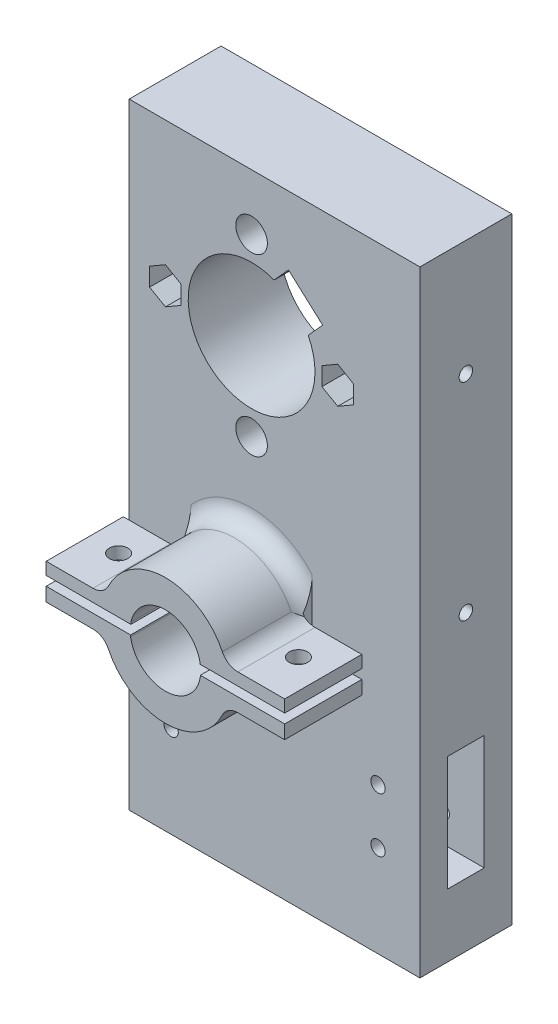
from build123d import *

# Parameters (mm, degrees)
SKETCH1_W           = 42.62295082
SKETCH1_H           = 50
SKETCH1_R           = 2.75
BOSS_EXTRUDE1_DEPTH = 16
SKETCH2_R           = 11.04
CUT_EXTRUDE2_DEPTH  = 37.540101042
SKETCH3_R           = 1.75
CUT_EXTRUDE3_DEPTH  = 10
CUT_EXTRUDE6_START  = -5
CUT_EXTRUDE6_DEPTH  = 32.540101042
SKETCH30_W          = 42.62295082
SKETCH30_H          = 16
BOSS_EXTRUDE8_DEPTH = 20.23
SKETCH10_W          = 42.62295082
SKETCH10_H          = 22
BOSS_EXTRUDE2_DEPTH = 16
SKETCH14_W          = 6.4
SKETCH14_H          = 16
CUT_EXTRUDE7_DEPTH  = 82.194758677
BOSS_EXTRUDE3_DEPTH = 8
CUT_EXTRUDE9_DEPTH  = 8
SKETCH18_W          = 0.9
SKETCH18_H          = 4
SKETCH18_W_2        = 1.8
CUT_EXTRUDE10_DEPTH = 10.2
SKETCH20_W          = 8
SKETCH20_H          = 16
BOSS_EXTRUDE5_DEPTH = 16
SKETCH21_W          = 8
SKETCH21_H          = 6.4
CUT_EXTRUDE11_DEPTH = 16
SKETCH24_W          = 50.62295082
SKETCH24_H          = 4.8
BOSS_EXTRUDE6_DEPTH = 15
SKETCH25_W          = 50.62295082
SKETCH25_H          = 15
BOSS_EXTRUDE7_DEPTH = 11.2
SKETCH26_R          = 1
CUT_EXTRUDE13_DEPTH = 10
SKETCH27_W          = 4
SKETCH27_H          = 1.8
CUT_EXTRUDE14_DEPTH = 10.2
BOSS_EXTRUDE9_DEPTH = 15
SKETCH35_R          = 6.145
CUT_EXTRUDE17_DEPTH = 89.752101331
SKETCH46_R          = 1.6
CUT_EXTRUDE29_DEPTH = 116.405526257
SKETCH47_W          = 10.199129155
SKETCH47_H          = 1.570077555
CUT_EXTRUDE30_DEPTH = 93.638736448
FILLET1_R           = 3
FILLET2_R           = 3
CUT_EXTRUDE31_DEPTH = 93.638736482
SKETCH50_W          = 6.4
SKETCH50_H          = 4
CUT_EXTRUDE33_DEPTH = 102.417237469
SKETCH51_R          = 1.25
CUT_EXTRUDE34_DEPTH = 93.638736482
CUT_EXTRUDE35_REACH = 94.639
SKETCH52_W          = 20
SKETCH52_H          = 14


with BuildPart() as part:
    # Sketch1 → Boss-Extrude1 (new body)
    with BuildSketch(Plane.XY):
        Rectangle(SKETCH1_W, SKETCH1_H)
        with Locations((0, 15.25)):
            Circle(SKETCH1_R, mode=Mode.SUBTRACT)
        with Locations((0, -15.25)):
            Circle(SKETCH1_R, mode=Mode.SUBTRACT)
    extrude(amount=BOSS_EXTRUDE1_DEPTH)

    # Sketch2 → Cut-Extrude2 (cut, through all)
    with BuildSketch(Plane.XY):
        Circle(SKETCH2_R)
    extrude(amount=CUT_EXTRUDE2_DEPTH, mode=Mode.SUBTRACT)

    # Sketch3 → Cut-Extrude3 (cut)
    with BuildSketch(Plane(origin=(0, 0, 0), x_dir=(-1, 0, 0), z_dir=(0, 0, -1))):
        with Locations((-15, 0)):
            Circle(SKETCH3_R)
        with Locations(Location((15, 0, 0), (0, 0, 180))):
            Circle(SKETCH3_R)
    extrude(amount=-CUT_EXTRUDE3_DEPTH, mode=Mode.SUBTRACT)

    # Sketch9 → Cut-Extrude6 (cut, through all)
    with BuildSketch(Plane(origin=(0, 0, 0), x_dir=(-1, 0, 0), z_dir=(0, 0, -1)).offset(CUT_EXTRUDE6_START)):
        Polygon((-15, 3.175426481), (-17.75, 1.58771324), (-17.75, -1.58771324), (-15, -3.175426481), (-12.25, -1.58771324), (-12.25, 1.58771324), align=None)
        Polygon((12.25, 1.58771324), (15, 3.175426481), (17.75, 1.58771324), (17.75, -1.58771324), (15, -3.175426481), (12.25, -1.58771324), align=None)
    extrude(amount=-CUT_EXTRUDE6_DEPTH, mode=Mode.SUBTRACT)

    # Sketch30 → Boss-Extrude8 (add)
    with BuildSketch(Plane.XZ.offset(25)):
        with Locations((0, 8)):
            Rectangle(SKETCH30_W, SKETCH30_H)
    extrude(amount=BOSS_EXTRUDE8_DEPTH)

    # Sketch10 → Boss-Extrude2 (add)
    with BuildSketch(Plane.XY):
        with Locations((0, -56.23)):
            Rectangle(SKETCH10_W, SKETCH10_H)
    extrude(amount=BOSS_EXTRUDE2_DEPTH)

    # Sketch14 → Cut-Extrude7 (cut, through all)
    with BuildSketch(Plane.ZY.offset(21.31147541)):
        with Locations((8, -59.23)):
            Rectangle(SKETCH14_W, SKETCH14_H)
    extrude(amount=-CUT_EXTRUDE7_DEPTH, mode=Mode.SUBTRACT)

    # Sketch16 → Boss-Extrude3 (add)
    with BuildSketch(Plane(origin=(21.31147541, 0, 0), x_dir=(0, 0, -1), z_dir=(1, 0, 0))):
        Polygon((-11.2, -51.23), (-8, -51.23), (-8, 25), (-16, 25), (-16, -51.23), align=None)
        Polygon((-8, 25), (-8, -51.23), (-4.8, -51.23), (0, -51.23), (0, 25), align=None)
    extrude(amount=BOSS_EXTRUDE3_DEPTH)

    # Sketch17 → Cut-Extrude9 (cut)
    with BuildSketch(Plane(origin=(29.31147541, 0, 0), x_dir=(0, 0, -1), z_dir=(1, 0, 0))):
        with BuildLine():
            ThreePointArc((-8, 6.06), (-9.175, 4.885), (-8, 3.71))
            Line((-8, 3.71), (-8, 6.06))
        make_face()
        with BuildLine():
            Line((-8, 6.06), (-8, 3.71))
            ThreePointArc((-8, 3.71), (-7.169149532, 4.054149532), (-6.825, 4.885))
            ThreePointArc((-6.825, 4.885), (-7.169149532, 5.715850468), (-8, 6.06))
        make_face()
        with BuildLine():
            ThreePointArc((-8, -29.94), (-9.175, -31.115), (-8, -32.29))
            Line((-8, -32.29), (-8, -29.94))
        make_face()
        with BuildLine():
            Line((-8, -29.94), (-8, -32.29))
            ThreePointArc((-8, -32.29), (-7.169149532, -31.945850468), (-6.825, -31.115))
            ThreePointArc((-6.825, -31.115), (-7.169149532, -30.284149532), (-8, -29.94))
        make_face()
    extrude(amount=-CUT_EXTRUDE9_DEPTH, mode=Mode.SUBTRACT)

    # Sketch18 → Cut-Extrude10 (cut)
    with BuildSketch(Plane(origin=(0, 0, 0), x_dir=(-1, 0, 0), z_dir=(0, 0, -1))):
        with Locations((-24.86147541, 4.885)):
            Rectangle(SKETCH18_W, SKETCH18_H)
        with Locations((-25.76147541, 4.885)):
            Rectangle(SKETCH18_W, SKETCH18_H)
        with Locations((-25.31147541, -31.115)):
            Rectangle(SKETCH18_W_2, SKETCH18_H)
    extrude(amount=-CUT_EXTRUDE10_DEPTH, mode=Mode.SUBTRACT)

    # Sketch20 → Boss-Extrude5 (add)
    with BuildSketch(Plane(origin=(0, -51.23, 0), x_dir=(-1, 0, 0), z_dir=(0, -1, 0))):
        with Locations((-25.31147541, -8)):
            Rectangle(SKETCH20_W, SKETCH20_H)
    extrude(amount=BOSS_EXTRUDE5_DEPTH)

    # Sketch21 → Cut-Extrude11 (cut)
    with BuildSketch(Plane(origin=(0, -67.23, 0), x_dir=(-1, 0, 0), z_dir=(0, -1, 0))):
        with Locations((-25.31147541, -8)):
            Rectangle(SKETCH21_W, SKETCH21_H)
    extrude(amount=-CUT_EXTRUDE11_DEPTH, mode=Mode.SUBTRACT)

    # Sketch24 → Boss-Extrude6 (add)
    with BuildSketch(Plane.XZ.offset(67.23)):
        with Locations((4, 2.4)):
            Rectangle(SKETCH24_W, SKETCH24_H)
    extrude(amount=BOSS_EXTRUDE6_DEPTH)

    # Sketch25 → Boss-Extrude7 (add)
    with BuildSketch(Plane.XY.offset(4.8)):
        with Locations((4, -74.73)):
            Rectangle(SKETCH25_W, SKETCH25_H)
    extrude(amount=BOSS_EXTRUDE7_DEPTH)

    # Sketch26 → Cut-Extrude13 (cut)
    with BuildSketch(Plane.XZ.offset(82.23)):
        with BuildLine():
            ThreePointArc((-15, 8), (-14, 7), (-13, 8))
            Line((-13, 8), (-15, 8))
        make_face()
        with BuildLine():
            Line((-15, 8), (-13, 8))
            ThreePointArc((-13, 8), (-14, 9), (-15, 8))
        make_face()
        with Locations(Location((22, 8, 0), (0, 0, 270))):
            Circle(SKETCH26_R)
    extrude(amount=-CUT_EXTRUDE13_DEPTH, mode=Mode.SUBTRACT)

    # Sketch27 → Cut-Extrude14 (cut)
    with BuildSketch(Plane(origin=(0, 0, 0), x_dir=(-1, 0, 0), z_dir=(0, 0, -1))):
        with Locations((-22.00147541, -78.23)):
            Rectangle(SKETCH27_W, SKETCH27_H)
        with Locations((14.00147541, -78.23)):
            Rectangle(SKETCH27_W, SKETCH27_H)
    extrude(amount=-CUT_EXTRUDE14_DEPTH, mode=Mode.SUBTRACT)

    # Sketch32 → Boss-Extrude9 (add)
    with BuildSketch(Plane.XY.offset(16)):
        with BuildLine():
            Line((10.560909988, -36.923121675), (20.760039143, -36.923121675))
            Line((20.760039143, -36.923121675), (20.760039143, -39.06409338))
            Line((20.760039143, -39.06409338), (17.514447618, -39.06409338))
            Line((17.514447618, -39.06409338), (6.023877341, -39.06409338))
            Line((6.023877341, -39.06409338), (6.014447618, -38.74006157))
            ThreePointArc((6.014447618, -38.74006157), (0, -33.855), (-6.014447618, -38.74006157))
            Line((-6.014447618, -38.74006157), (-6.014447618, -39.06409338))
            Line((-6.014447618, -39.06409338), (-19.188118152, -39.06409338))
            Line((-19.188118152, -39.06409338), (-20.760039143, -39.06409338))
            Line((-20.760039143, -39.06409338), (-20.760039143, -36.923121675))
            Line((-20.760039143, -36.923121675), (-10.560909988, -36.923121675))
            ThreePointArc((-10.560909988, -36.923121675), (0, -29), (10.560909988, -36.923121675))
        make_face()
        with BuildLine():
            Line((-18.351282885, -40.691776253), (-6.068785984, -40.691776253))
            Line((-6.068785984, -40.691776253), (-6.068785984, -40.964811733))
            ThreePointArc((-6.068785984, -40.964811733), (0, -46.145), (6.068785984, -40.964811733))
            Line((6.068785984, -40.964811733), (6.068785984, -40.691776253))
            Line((6.068785984, -40.691776253), (18.351282885, -40.691776253))
            Line((18.351282885, -40.691776253), (20.760039143, -40.691776253))
            Line((20.760039143, -40.691776253), (20.760039143, -43.076878325))
            Line((20.760039143, -43.076878325), (10.560909988, -43.076878325))
            ThreePointArc((10.560909988, -43.076878325), (0, -51), (-10.560909988, -43.076878325))
            Line((-10.560909988, -43.076878325), (-20.760039143, -43.076878325))
            Line((-20.760039143, -43.076878325), (-20.760039143, -40.691776253))
            Line((-20.760039143, -40.691776253), (-18.351282885, -40.691776253))
        make_face()
    extrude(amount=BOSS_EXTRUDE9_DEPTH)

    # Sketch35 → Cut-Extrude17 (cut, through all)
    with BuildSketch(Plane.XY.offset(16)):
        with Locations(Location((0, -40, 0), (0, 0, 186.463801437))):
            Circle(SKETCH35_R)
    extrude(amount=-CUT_EXTRUDE17_DEPTH, mode=Mode.SUBTRACT)

    # Sketch46 → Cut-Extrude29 (cut, through all)
    with BuildSketch(Plane.XZ.offset(82.23)):
        with Locations(Location((-15.660039143, 23.5, 0), (0, 0, 270))):
            Circle(SKETCH46_R)
        with Locations(Location((15.660039143, 23.5, 0), (0, 0, 270))):
            Circle(SKETCH46_R)
    extrude(amount=-CUT_EXTRUDE29_DEPTH, mode=Mode.SUBTRACT)

    # Sketch47 → Cut-Extrude30 (cut, through all)
    with BuildSketch(Plane(origin=(0, 0, 0), x_dir=(1, 0, 0), z_dir=(0, 1, 0))):
        with Locations((-15.660474565, -16.785038777)):
            Rectangle(SKETCH47_W, SKETCH47_H)
        with Locations((15.660474565, -16.785038777)):
            Rectangle(SKETCH47_W, SKETCH47_H)
    extrude(amount=-CUT_EXTRUDE30_DEPTH, mode=Mode.SUBTRACT)

    # Fillet1
    # the kernel refuses this fillet: 3 mm, written as the material it adds along each edge
    with BuildSketch(Plane(origin=(0, -40, 16), x_dir=(0.9214282650932413, 0.3885485198623971, 0), z_dir=(-0.3885485198623971, 0.9214282650932413, 0))) as fillet1_piece_1_section:
        with BuildLine():
            CenterArc((11 + FILLET1_R, -FILLET1_R), FILLET1_R, 90, 90)
            Line((11, -FILLET1_R), (11, 0))
            Line((11, 0), (11 + FILLET1_R, 0))
        make_face()
    fillet1_piece_1 = revolve(axis=Axis((0, -40, 16), (0, 0, -1)), revolution_arc=225.72842835, mode=Mode.PRIVATE)
    fillet1_piece_1 = split(fillet1_piece_1, bisect_by=Plane(origin=(10.560909988, -40, 16), z_dir=(-1, 0, 0)), keep=Keep.TOP, mode=Mode.PRIVATE)
    fillet1_piece_1 = split(fillet1_piece_1, bisect_by=Plane(origin=(-10.560909988, -40, 16), z_dir=(1, 0, 0)), keep=Keep.TOP, mode=Mode.PRIVATE)
    add(fillet1_piece_1)
    with BuildSketch(Plane(origin=(0, -40, 16), x_dir=(0.9214282650932413, 0.3885485198623971, 0), z_dir=(-0.3885485198623971, 0.9214282650932413, 0))) as fillet1_piece_2_section:
        with BuildLine():
            CenterArc((11 + FILLET1_R, -FILLET1_R), FILLET1_R, 90, 90)
            Line((11, -FILLET1_R), (11, 0))
            Line((11, 0), (11 + FILLET1_R, 0))
        make_face()
    fillet1_piece_2 = revolve(axis=Axis((0, -40, 16), (0, 0, -1)), revolution_arc=225.72842835, mode=Mode.PRIVATE)
    fillet1_piece_2 = split(fillet1_piece_2, bisect_by=Plane(origin=(0, -40, 17.570077555), z_dir=(0, 0, 1)), keep=Keep.TOP, mode=Mode.PRIVATE)
    fillet1_piece_2 = split(fillet1_piece_2, bisect_by=Plane(origin=(0, -36.923121675, 16), z_dir=(0, 1, 0)), keep=Keep.TOP, mode=Mode.PRIVATE)
    add(fillet1_piece_2)
    with BuildSketch(Plane(origin=(0, -40, 16), x_dir=(0.9214282650932413, 0.3885485198623971, 0), z_dir=(-0.3885485198623971, 0.9214282650932413, 0))) as fillet1_piece_3_section:
        with BuildLine():
            CenterArc((11 + FILLET1_R, -FILLET1_R), FILLET1_R, 90, 90)
            Line((11, -FILLET1_R), (11, 0))
            Line((11, 0), (11 + FILLET1_R, 0))
        make_face()
    fillet1_piece_3 = revolve(axis=Axis((0, -40, 16), (0, 0, -1)), revolution_arc=225.72842835, mode=Mode.PRIVATE)
    fillet1_piece_3 = split(fillet1_piece_3, bisect_by=Plane(origin=(0, -43.076878325, 16), z_dir=(0, -1, 0)), keep=Keep.TOP, mode=Mode.PRIVATE)
    fillet1_piece_3 = split(fillet1_piece_3, bisect_by=Plane(origin=(0, -40, 17.570077555), z_dir=(0, 0, 1)), keep=Keep.TOP, mode=Mode.PRIVATE)
    add(fillet1_piece_3)
    with BuildSketch(Plane(origin=(0, -40, 16), x_dir=(-0.9214282650932415, -0.3885485198623964, 0), z_dir=(0.3885485198623964, -0.9214282650932415, 0))) as fillet1_piece_4_section:
        with BuildLine():
            CenterArc((11 + FILLET1_R, -FILLET1_R), FILLET1_R, 90, 90)
            Line((11, -FILLET1_R), (11, 0))
            Line((11, 0), (11 + FILLET1_R, 0))
        make_face()
    fillet1_piece_4 = revolve(axis=Axis((0, -40, 16), (0, 0, -1)), revolution_arc=225.72842835, mode=Mode.PRIVATE)
    fillet1_piece_4 = split(fillet1_piece_4, bisect_by=Plane(origin=(10.560909988, -40, 16), z_dir=(-1, 0, 0)), keep=Keep.TOP, mode=Mode.PRIVATE)
    fillet1_piece_4 = split(fillet1_piece_4, bisect_by=Plane(origin=(-10.560909988, -40, 16), z_dir=(1, 0, 0)), keep=Keep.TOP, mode=Mode.PRIVATE)
    add(fillet1_piece_4)
    with BuildSketch(Plane(origin=(0, -40, 16), x_dir=(-0.9214282650932415, -0.3885485198623964, 0), z_dir=(0.3885485198623964, -0.9214282650932415, 0))) as fillet1_piece_5_section:
        with BuildLine():
            CenterArc((11 + FILLET1_R, -FILLET1_R), FILLET1_R, 90, 90)
            Line((11, -FILLET1_R), (11, 0))
            Line((11, 0), (11 + FILLET1_R, 0))
        make_face()
    fillet1_piece_5 = revolve(axis=Axis((0, -40, 16), (0, 0, -1)), revolution_arc=225.72842835, mode=Mode.PRIVATE)
    fillet1_piece_5 = split(fillet1_piece_5, bisect_by=Plane(origin=(0, -43.076878325, 16), z_dir=(0, -1, 0)), keep=Keep.TOP, mode=Mode.PRIVATE)
    fillet1_piece_5 = split(fillet1_piece_5, bisect_by=Plane(origin=(0, -40, 17.570077555), z_dir=(0, 0, 1)), keep=Keep.TOP, mode=Mode.PRIVATE)
    add(fillet1_piece_5)
    with BuildSketch(Plane(origin=(0, -40, 16), x_dir=(-0.9214282650932415, -0.3885485198623964, 0), z_dir=(0.3885485198623964, -0.9214282650932415, 0))) as fillet1_piece_6_section:
        with BuildLine():
            CenterArc((11 + FILLET1_R, -FILLET1_R), FILLET1_R, 90, 90)
            Line((11, -FILLET1_R), (11, 0))
            Line((11, 0), (11 + FILLET1_R, 0))
        make_face()
    fillet1_piece_6 = revolve(axis=Axis((0, -40, 16), (0, 0, -1)), revolution_arc=225.72842835, mode=Mode.PRIVATE)
    fillet1_piece_6 = split(fillet1_piece_6, bisect_by=Plane(origin=(0, -40, 17.570077555), z_dir=(0, 0, 1)), keep=Keep.TOP, mode=Mode.PRIVATE)
    fillet1_piece_6 = split(fillet1_piece_6, bisect_by=Plane(origin=(0, -36.923121675, 16), z_dir=(0, 1, 0)), keep=Keep.TOP, mode=Mode.PRIVATE)
    add(fillet1_piece_6)

    # Fillet2
    # the kernel refuses this fillet: 3 mm, written as the material it adds along each edge
    with BuildSketch(Plane(origin=(-10.560909988, -43.076878325, 13.871382398), x_dir=(-1, 0, 0), z_dir=(0, 0, 1))) as fillet2_piece_1_section:
        with BuildLine():
            CenterArc((2.051447041, 3), FILLET2_R, 205.725669398, 64.274330602)
            ThreePointArc((-0.651200894, 1.697811787), (-0.290457095, 0.862385233), (0, 0))
            Line((0, 0), (2.051447041, 0))
        make_face()
    fillet2_piece_1 = extrude(amount=17.128617602, mode=Mode.PRIVATE)
    fillet2_piece_1 = split(fillet2_piece_1, bisect_by=Plane(origin=(-10.560909988, -43.076878325, 17.570077555), z_dir=(0, 0, 1)), keep=Keep.TOP, mode=Mode.PRIVATE)
    add(fillet2_piece_1)
    with BuildSketch(Plane(origin=(-10.560909988, -36.923121675, 13.871382398), x_dir=(0.35811486899098127, 0.9336775356661273, 0), z_dir=(0, 0, 1))) as fillet2_piece_2_section:
        with BuildLine():
            CenterArc((2.066378919, 2.989734625), FILLET2_R, 200.984468726, 64.274330602)
            Line((-0.734653688, 1.915390018), (0, 0))
            ThreePointArc((0, 0), (0.909206724, 0.03763971), (1.818413448, 0))
        make_face()
    fillet2_piece_2 = extrude(amount=17.128617602, mode=Mode.PRIVATE)
    fillet2_piece_2 = split(fillet2_piece_2, bisect_by=Plane(origin=(-10.560909988, -36.923121675, 17.570077555), z_dir=(0, 0, 1)), keep=Keep.TOP, mode=Mode.PRIVATE)
    add(fillet2_piece_2)
    with BuildSketch(Plane(origin=(10.560909988, -36.923121675, 13.871382398), x_dir=(1, 0, 0), z_dir=(0, 0, 1))) as fillet2_piece_3_section:
        with BuildLine():
            CenterArc((2.051447041, 3), FILLET2_R, 205.725669398, 64.274330602)
            ThreePointArc((-0.651200894, 1.697811787), (-0.290457095, 0.862385233), (0, 0))
            Line((0, 0), (2.051447041, 0))
        make_face()
    fillet2_piece_3 = extrude(amount=17.128617602, mode=Mode.PRIVATE)
    fillet2_piece_3 = split(fillet2_piece_3, bisect_by=Plane(origin=(10.560909988, -36.923121675, 17.570077555), z_dir=(0, 0, 1)), keep=Keep.TOP, mode=Mode.PRIVATE)
    add(fillet2_piece_3)
    with BuildSketch(Plane(origin=(10.560909988, -43.076878325, 13.871382398), x_dir=(1, 0, 0), z_dir=(0, 0, 1))) as fillet2_piece_4_section:
        with BuildLine():
            CenterArc((2.051447041, -3), FILLET2_R, 90, 64.274330602)
            ThreePointArc((-0.651200894, -1.697811787), (-0.290457095, -0.862385233), (0, 0))
            Line((0, 0), (2.051447041, 0))
        make_face()
    fillet2_piece_4 = extrude(amount=17.128617602, mode=Mode.PRIVATE)
    fillet2_piece_4 = split(fillet2_piece_4, bisect_by=Plane(origin=(10.560909988, -43.076878325, 17.570077555), z_dir=(0, 0, 1)), keep=Keep.TOP, mode=Mode.PRIVATE)
    add(fillet2_piece_4)

    # Sketch49 → Cut-Extrude31 (cut, through all)
    with BuildSketch(Plane(origin=(0, 0, 0), x_dir=(-1, 0, 0), z_dir=(0, 0, -1))):
        Polygon((-10.363547601, 5.520731937), (-7.392793825, 8.199280424), (-4.422040048, 10.877828911), (-6.430951413, 13.105894243), (-12.372458967, 7.748797269), align=None)
        with BuildLine():
            ThreePointArc((-9.861238414, 4.963625383), (-8.777401267, 6.69618003), (-7.392793825, 8.199280424))
            Line((-7.392793825, 8.199280424), (-10.363547601, 5.520731937))
            Line((-10.363547601, 5.520731937), (-9.861238414, 4.963625383))
        make_face()
        with BuildLine():
            Line((-4.422040048, 10.877828911), (-7.392793825, 8.199280424))
            ThreePointArc((-7.392793825, 8.199280424), (-5.754861654, 9.421420665), (-3.91973086, 10.320722358))
            Line((-3.91973086, 10.320722358), (-4.422040048, 10.877828911))
        make_face()
    extrude(amount=-CUT_EXTRUDE31_DEPTH, mode=Mode.SUBTRACT)

    # Sketch50 → Cut-Extrude33 (cut, through all)
    with BuildSketch(Plane.ZY.offset(21.31147541)):
        with Locations((8, -69.23)):
            Rectangle(SKETCH50_W, SKETCH50_H)
    extrude(amount=-CUT_EXTRUDE33_DEPTH, mode=Mode.SUBTRACT)

    # Sketch51 → Cut-Extrude34 (cut, through all)
    with BuildSketch(Plane(origin=(0, 0, 0), x_dir=(-1, 0, 0), z_dir=(0, 0, -1))):
        with Locations((14.01147541, -66.23)):
            Circle(SKETCH51_R)
        with Locations((-22.01147541, -56.73)):
            Circle(SKETCH51_R)
        with Locations((-22.01147541, -66.23)):
            Circle(SKETCH51_R)
        with Locations((14.01147541, -56.73)):
            Circle(SKETCH51_R)
    extrude(amount=-CUT_EXTRUDE34_DEPTH, mode=Mode.SUBTRACT)

    # Sketch52 → Cut-Extrude35 (cut, up to next)
    with BuildSketch(Plane(origin=(0, 0, 0), x_dir=(-1, 0, 0), z_dir=(0, 0, -1)), mode=Mode.PRIVATE) as cut_extrude35_sk1:
        with Locations((-3.992469291, -62.23)):
            Rectangle(SKETCH52_W, SKETCH52_H)
    cut_extrude35_tool1 = extrude(cut_extrude35_sk1.sketch, amount=-CUT_EXTRUDE35_REACH, mode=Mode.PRIVATE) & part.part
    add(cut_extrude35_tool1.solids().sort_by_distance((3.992469, -62.23, 0))[0], mode=Mode.SUBTRACT)


solid = part.part
